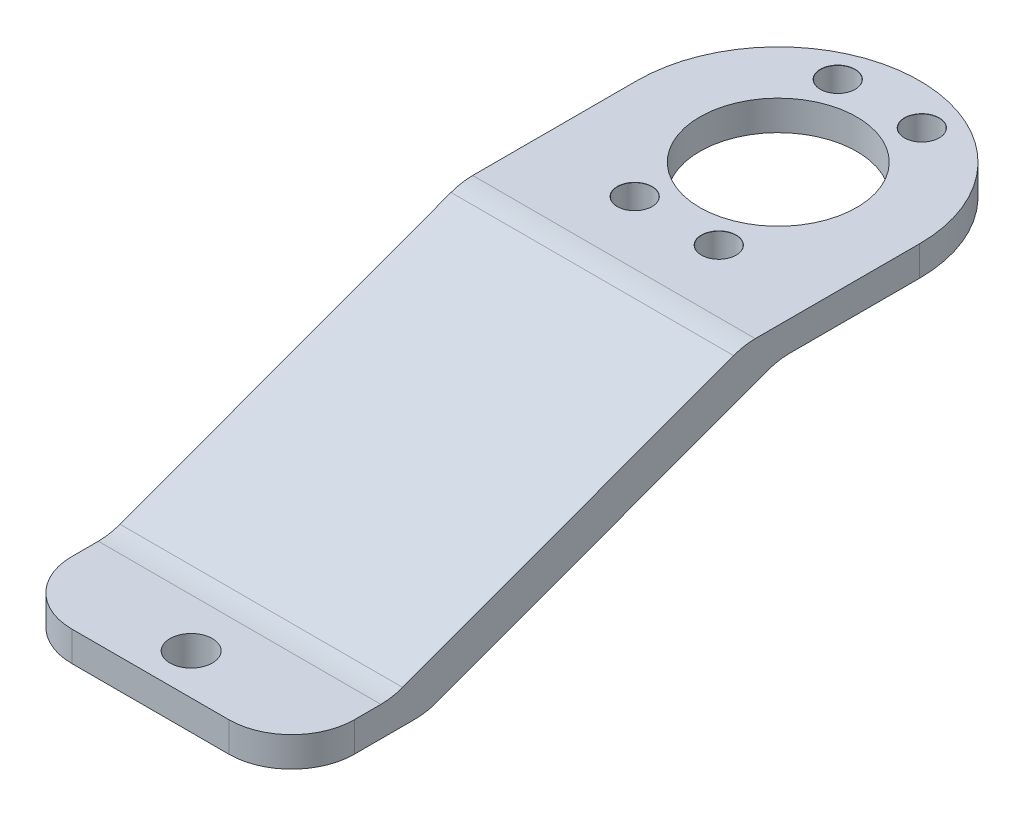
from build123d import *

# Parameters (mm, degrees)
BOSS_EXTRUDE1_DEPTH            = 25.4
M5_CLEARANCE_HOLE1_D           = 5.5
M5_CLEARANCE_HOLE1_CSINK_D     = 5.55
M5_CLEARANCE_HOLE1_CSINK_ANGLE = 90
SKETCH5_R                      = 12.5
CUT_EXTRUDE1_DEPTH             = 106.600236426
SKETCH6_R                      = 3.3782
CUT_EXTRUDE2_DEPTH             = 106.600236426
FILLET1_R                      = 10
CUT_EXTRUDE4_DEPTH             = 113.561804948
FILLET2_R                      = 10


with BuildPart() as part:
    # Sketch1 → Boss-Extrude1 (new body)
    with BuildSketch(Plane(origin=(0, 0, 0), x_dir=(1, 0, 0), z_dir=(0, 1, 0))):
        with BuildLine():
            Line((-22.5, -99.999999666), (22.5, -99.999999666))
            Line((22.5, -99.999999666), (22.5, 3.34e-07))
            ThreePointArc((22.5, 3.34e-07), (0, 22.5), (-22.5, 3.34e-07))
            Line((-22.5, 3.34e-07), (-22.5, -99.999999666))
        make_face()
    extrude(amount=BOSS_EXTRUDE1_DEPTH)

    # M5 Clearance Hole1 (through all)
    with Locations(Plane(origin=(0, 25.4, 0), x_dir=(1, 0, 0), z_dir=(0, 1, 0))):
        with Locations((-6.696960066, -16.167891819), (6.696960066, -16.167891819), (6.696960066, 16.167891819), (-6.696960066, 16.167891819)):
            CounterSinkHole(M5_CLEARANCE_HOLE1_D / 2, M5_CLEARANCE_HOLE1_CSINK_D / 2, counter_sink_angle=M5_CLEARANCE_HOLE1_CSINK_ANGLE)

    # Sketch5 → Cut-Extrude1 (cut, through all)
    with BuildSketch(Plane(origin=(0, 25.4, 0), x_dir=(1, 0, 0), z_dir=(0, 1, 0))):
        Circle(SKETCH5_R)
    extrude(amount=-CUT_EXTRUDE1_DEPTH, mode=Mode.SUBTRACT)

    # Sketch6 → Cut-Extrude2 (cut, through all)
    with BuildSketch(Plane(origin=(0, 25.4, 0), x_dir=(1, 0, 0), z_dir=(0, 1, 0))):
        with Locations((0, -93.499999666)):
            Circle(SKETCH6_R)
    extrude(amount=-CUT_EXTRUDE2_DEPTH, mode=Mode.SUBTRACT)

    # Fillet1
    fillet1_edges = [part.edges().sort_by_distance(p)[0] for p in [
        (22.5, 12.7, 99.999999666),
        (-22.5, 12.7, 99.999999666),
    ]]
    fillet(fillet1_edges, radius=FILLET1_R)

    # Sketch9 → Cut-Extrude4 (cut, through all)
    with BuildSketch(Plane.ZY.offset(22.5)):
        Polygon((-22.5, 0), (-22.5, 20.6375), (22.5, 20.6375), (78.55621557, 0), align=None)
        Polygon((27.943784096, 25.4), (83.999999666, 4.7625), (99.999999666, 4.7625), (99.999999666, 25.4), align=None)
    extrude(amount=-CUT_EXTRUDE4_DEPTH, mode=Mode.SUBTRACT)

    # Fillet2
    fillet2_edges = [part.edges().sort_by_distance(p)[0] for p in [
        (0, 0, 78.55621557),
        (0, 4.7625, 83.999999666),
        (0, 20.6375, 22.5),
        (0, 25.4, 27.943784096),
    ]]
    fillet(fillet2_edges, radius=FILLET2_R)


solid = part.part
